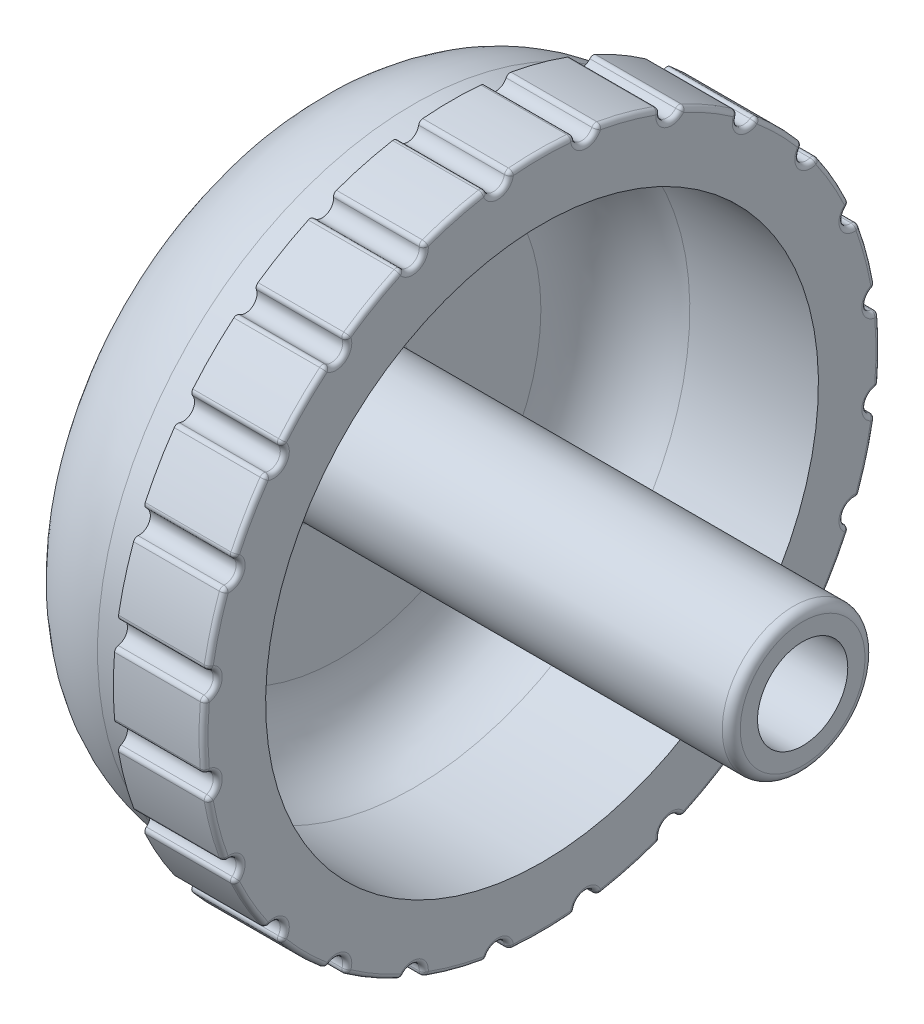
from build123d import *

# Parameters (mm, degrees)
SKETCH1_R           = 15
BOSS_EXTRUDE1_DEPTH = 4
SKETCH4_R           = 0.5
CUT_EXTRUDE1_DEPTH  = 23.401785643
FILLET1_R           = 0.2
FILLET2_R           = 0.2
SKETCH6_R           = 3.165
SKETCH6_R_2         = 2
BOSS_EXTRUDE2_DEPTH = 20.55
FILLET3_R           = 0.4
FILLET4_R           = 0.2


with BuildPart() as part:
    # Sketch1 → Boss-Extrude1 (new body)
    with BuildSketch(Plane(origin=(0, 0, 0), x_dir=(0, 0, -1), z_dir=(1, 0, 0))):
        Circle(SKETCH1_R)
    extrude(amount=BOSS_EXTRUDE1_DEPTH)

    # Sketch3 → Revolve1 (revolve)
    with BuildSketch(Plane(origin=(0, 0, 0), x_dir=(1, 0, 0), z_dir=(0, 1, 0))):
        with BuildLine():
            Line((0, 0), (0, 14))
            Line((0, 14), (-1.7, 14))
            ThreePointArc((-1.7, 14), (-5.589087297, 12.389087297), (-7.2, 8.5))
            Line((-7.2, 8.5), (-7.2, 0))
            Line((-7.2, 0), (0, 0))
        make_face()
    revolve(axis=Axis((0, 0, 0), (-1, 0, 0)))

    # Sketch4 → Cut-Extrude1 (cut, through all)
    with BuildSketch(Plane.ZY):
        with Locations((1.957892883, 14.871672921)):
            Circle(SKETCH4_R)
        with Locations((5.740251485, 13.858192988)):
            Circle(SKETCH4_R)
        with Locations((9.131421435, 11.900300104)):
            Circle(SKETCH4_R)
        with Locations((11.900300104, 9.131421435)):
            Circle(SKETCH4_R)
        with Locations((13.858192988, 5.740251485)):
            Circle(SKETCH4_R)
        with Locations((14.871672921, 1.957892883)):
            Circle(SKETCH4_R)
        with Locations((14.871672921, -1.957892883)):
            Circle(SKETCH4_R)
        with Locations((13.858192988, -5.740251485)):
            Circle(SKETCH4_R)
        with Locations((11.900300104, -9.131421435)):
            Circle(SKETCH4_R)
        with Locations((9.131421435, -11.900300104)):
            Circle(SKETCH4_R)
        with Locations((5.740251485, -13.858192988)):
            Circle(SKETCH4_R)
        with Locations((1.957892883, -14.871672921)):
            Circle(SKETCH4_R)
        with Locations((-1.957892883, -14.871672921)):
            Circle(SKETCH4_R)
        with Locations((-5.740251485, -13.858192988)):
            Circle(SKETCH4_R)
        with Locations((-9.131421435, -11.900300104)):
            Circle(SKETCH4_R)
        with Locations((-11.900300104, -9.131421435)):
            Circle(SKETCH4_R)
        with Locations((-13.858192988, -5.740251485)):
            Circle(SKETCH4_R)
        with Locations((-14.871672921, -1.957892883)):
            Circle(SKETCH4_R)
        with Locations((-14.871672921, 1.957892883)):
            Circle(SKETCH4_R)
        with Locations((-13.858192988, 5.740251485)):
            Circle(SKETCH4_R)
        with Locations((-11.900300104, 9.131421435)):
            Circle(SKETCH4_R)
        with Locations((-9.131421435, 11.900300104)):
            Circle(SKETCH4_R)
        with Locations((-5.740251485, 13.858192988)):
            Circle(SKETCH4_R)
        with Locations((-1.957892883, 14.871672921)):
            Circle(SKETCH4_R)
    extrude(amount=-CUT_EXTRUDE1_DEPTH, mode=Mode.SUBTRACT)

    # Fillet1
    fillet1_edges = [part.edges().sort_by_distance(p)[0] for p in [
        (2, -14.041809131, 5.275186853),
        (2, -14.798156849, 2.452458741),
        (2, -14.928664911, 1.461151589),
        (2, -14.928664911, -1.461151589),
        (2, -14.798156849, -2.452458741),
        (2, -14.041809131, -5.275186853),
        (2, -13.659178852, -6.19893806),
        (2, 14.928664911, 1.461151589),
        (2, 14.798156849, 2.452458741),
        (2, -12.198027263, -8.729726851),
        (2, -11.58935039, -9.522969996),
        (2, -9.522969996, -11.58935039),
        (2, -8.729726851, -12.198027263),
        (2, -6.19893806, -13.659178852),
        (2, -5.275186853, -14.041809131),
        (2, -2.452458741, -14.798156849),
        (2, -1.461151589, -14.928664911),
        (2, 1.461151589, -14.928664911),
        (2, 2.452458741, -14.798156849),
        (2, 5.275186853, -14.041809131),
        (2, 6.19893806, -13.659178852),
        (2, 8.729726851, -12.198027263),
        (2, 9.522969996, -11.58935039),
        (2, 11.58935039, -9.522969996),
        (2, 12.198027263, -8.729726851),
        (2, 13.659178852, -6.19893806),
        (2, 14.041809131, -5.275186853),
        (2, 14.798156849, -2.452458741),
        (2, 14.928664911, -1.461151589),
        (2, 14.041809131, 5.275186853),
        (2, 13.659178852, 6.19893806),
        (2, 12.198027263, 8.729726851),
        (2, 11.58935039, 9.522969996),
        (2, 9.522969996, 11.58935039),
        (2, 8.729726851, 12.198027263),
        (2, 6.19893806, 13.659178852),
        (2, 5.275186853, 14.041809131),
        (2, 2.452458741, 14.798156849),
        (2, 1.461151589, 14.928664911),
        (2, -1.461151589, 14.928664911),
        (2, -2.452458741, 14.798156849),
        (2, -5.275186853, 14.041809131),
        (2, -6.19893806, 13.659178852),
        (2, -8.729726851, 12.198027263),
        (2, -9.522969996, 11.58935039),
        (2, -11.58935039, 9.522969996),
        (2, -12.198027263, 8.729726851),
        (2, -13.659178852, 6.19893806),
    ]]
    fillet(fillet1_edges, radius=FILLET1_R)

    # Fillet2
    fillet2_edges = [part.edges().sort_by_distance(p)[0] for p in [
        (4, 14.488887394, 3.882285677),
        (4, 14.37595049, 1.892629787),
        (4, 14.37595049, -1.892629787),
        (4, 15, 0),
        (4, 13.396253221, 5.548909769),
        (4, 12.990381057, 7.5),
        (4, 11.503623434, 8.827040721),
        (4, 10.606601718, 10.606601718),
        (4, 8.827040721, 11.503623434),
        (4, 7.5, 12.990381057),
        (4, 5.548909769, 13.396253221),
        (4, 3.882285677, 14.488887394),
        (4, 1.892629787, 14.37595049),
        (4, 0, 15),
        (4, -1.892629787, 14.37595049),
        (4, -3.882285677, 14.488887394),
        (4, -5.548909769, 13.396253221),
        (4, -7.5, 12.990381057),
        (4, -8.827040721, 11.503623434),
        (4, -10.606601718, 10.606601718),
        (4, -11.503623434, 8.827040721),
        (4, -12.990381057, 7.5),
        (4, -13.396253221, 5.548909769),
        (4, -14.488887394, 3.882285677),
        (4, -14.37595049, 1.892629787),
        (4, -15, 0),
        (4, -14.37595049, -1.892629787),
        (4, -14.488887394, -3.882285677),
        (4, -13.396253221, -5.548909769),
        (4, -12.990381057, -7.5),
        (4, -11.503623434, -8.827040721),
        (4, -10.606601718, -10.606601718),
        (4, -8.827040721, -11.503623434),
        (4, -7.5, -12.990381057),
        (4, -5.548909769, -13.396253221),
        (4, -3.882285677, -14.488887394),
        (4, -1.892629787, -14.37595049),
        (4, 0, -15),
        (4, 1.892629787, -14.37595049),
        (4, 3.882285677, -14.488887394),
        (4, 5.548909769, -13.396253221),
        (4, 7.5, -12.990381057),
        (4, 8.827040721, -11.503623434),
        (4, 10.606601718, -10.606601718),
        (4, 11.503623434, -8.827040721),
        (4, 12.990381057, -7.5),
        (4, 13.396253221, -5.548909769),
        (4, 14.488887394, -3.882285677),
        (4, 14.89346901, 1.403880543),
        (4, 14.89346901, -1.403880543),
        (4, 14.749337381, -2.498668954),
        (4, 14.022635338, -5.210757901),
        (4, 13.600062785, -6.230938291),
        (4, 12.196182241, -8.662530719),
        (4, 11.523966384, -9.53857948),
        (4, 9.53857948, -11.523966384),
        (4, 8.662530719, -12.196182241),
        (4, 6.230938291, -13.600062785),
        (4, 5.210757901, -14.022635338),
        (4, 2.498668954, -14.749337381),
        (4, 1.403880543, -14.89346901),
        (4, -1.403880543, -14.89346901),
        (4, -2.498668954, -14.749337381),
        (4, -5.210757901, -14.022635338),
        (4, -6.230938291, -13.600062785),
        (4, -8.662530719, -12.196182241),
        (4, -9.53857948, -11.523966384),
        (4, -11.523966384, -9.53857948),
        (4, -12.196182241, -8.662530719),
        (4, -13.600062785, -6.230938291),
        (4, -14.022635338, -5.210757901),
        (4, -14.749337381, -2.498668954),
        (4, -14.89346901, -1.403880543),
        (4, -14.89346901, 1.403880543),
        (4, -14.749337381, 2.498668954),
        (4, -14.022635338, 5.210757901),
        (4, -13.600062785, 6.230938291),
        (4, -12.196182241, 8.662530719),
        (4, -11.523966384, 9.53857948),
        (4, -9.53857948, 11.523966384),
        (4, -8.662530719, 12.196182241),
        (4, -6.230938291, 13.600062785),
        (4, -5.210757901, 14.022635338),
        (4, -2.498668954, 14.749337381),
        (4, -1.403880543, 14.89346901),
        (4, 1.403880543, 14.89346901),
        (4, 2.498668954, 14.749337381),
        (4, 5.210757901, 14.022635338),
        (4, 6.230938291, 13.600062785),
        (4, 8.662530719, 12.196182241),
        (4, 9.53857948, 11.523966384),
        (4, 11.523966384, 9.53857948),
        (4, 12.196182241, 8.662530719),
        (4, 13.600062785, 6.230938291),
        (4, 14.022635338, 5.210757901),
        (4, 14.749337381, 2.498668954),
    ]]
    fillet(fillet2_edges, radius=FILLET2_R - 0.0001)  # a hair under: the kernel refuses the full size

    # Sketch5 → Cut-Revolve1 (revolve, cut)
    with BuildSketch(Plane.XY, mode=Mode.PRIVATE) as cut_revolve1_sk:
        with BuildLine():
            Line((-5, 8.95), (-5, 0))
            Line((-5, 0), (4, 0))
            Line((4, 0), (4, 12.25))
            Line((4, 12.25), (-1.7, 12.25))
            ThreePointArc((-1.7, 12.25), (-4.033452378, 11.283452378), (-5, 8.95))
        make_face()
    revolve(cut_revolve1_sk.sketch.rotate(Axis((-5, 0, 0), (1, 0, 0)), 180), axis=Axis((-5, 0, 0), (1, 0, 0)), mode=Mode.SUBTRACT)

    # Sketch6 → Boss-Extrude2 (add)
    with BuildSketch(Plane(origin=(-5, 0, 0), x_dir=(0, 0, -1), z_dir=(1, 0, 0))):
        Circle(SKETCH6_R)
        Circle(SKETCH6_R_2, mode=Mode.SUBTRACT)
    extrude(amount=BOSS_EXTRUDE2_DEPTH)

    # Fillet3
    fillet3_edges = [part.edges().sort_by_distance(p)[0] for p in [
        (15.55, 0, 3.165),
    ]]
    fillet(fillet3_edges, radius=FILLET3_R)

    # Fillet4
    fillet4_edges = [part.edges().sort_by_distance(p)[0] for p in [
        (-5, 0, 3.165),
    ]]
    fillet(fillet4_edges, radius=FILLET4_R)


solid = part.part
